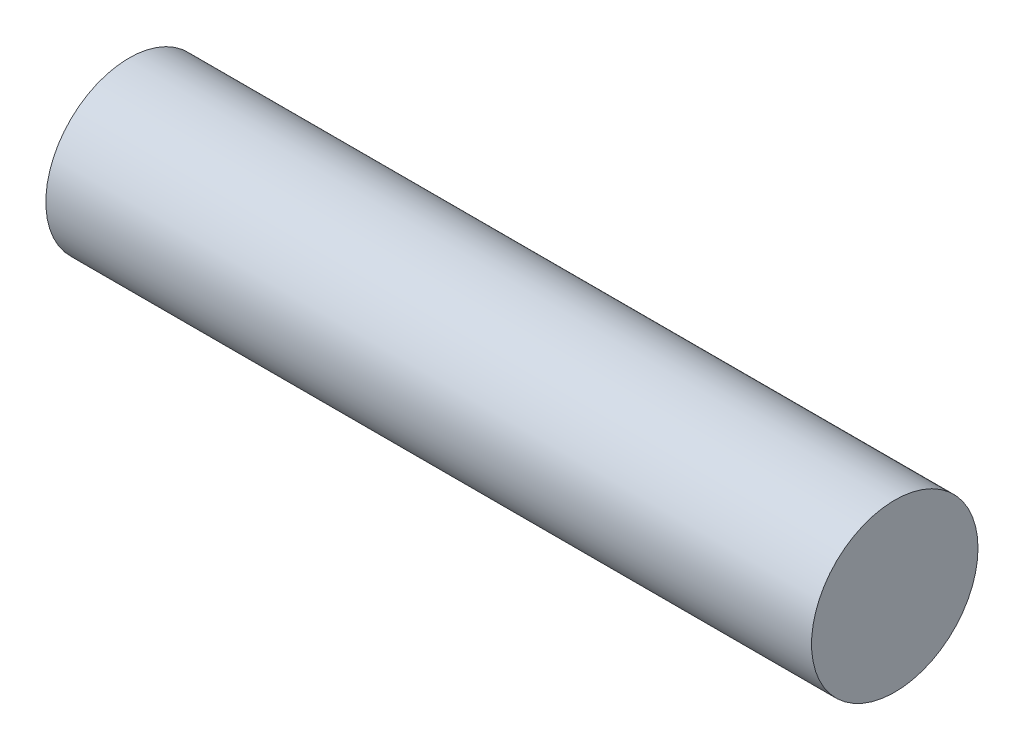
from build123d import *

# Parameters (mm, degrees)
SKETCH_1_R      = 2.5
EXTRUDE_1_DEPTH = 23


with BuildPart() as part:
    # 草图1 → 凸台-拉伸1 (new body)
    with BuildSketch(Plane(origin=(0, 0, 0), x_dir=(0, 0, -1), z_dir=(1, 0, 0))):
        Circle(SKETCH_1_R)
    extrude(amount=EXTRUDE_1_DEPTH)


solid = part.part
